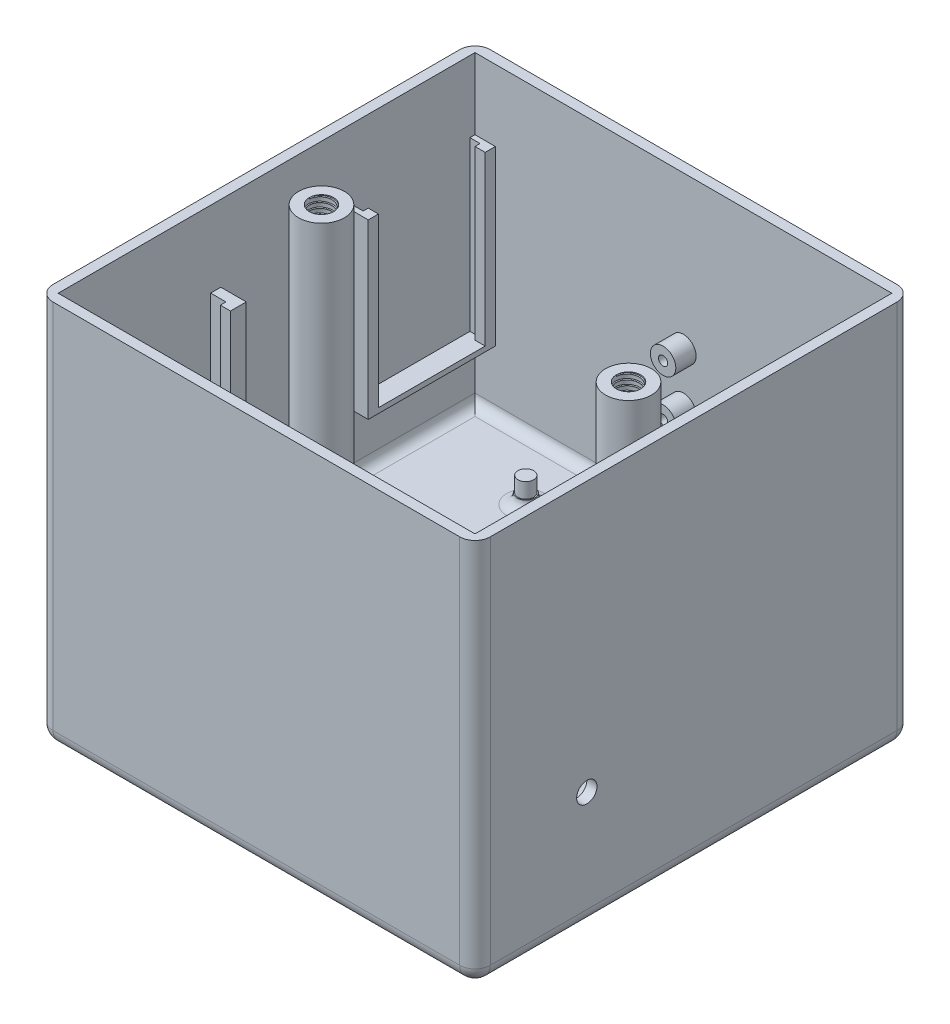
from build123d import *
from build123d.topology import SkipClean

# Parameters (mm, degrees)
SKETCH1_W               = 86
SKETCH1_H               = 86
BOSS_EXTRUDE1_DEPTH     = 76
SKETCH2_W               = 82
SKETCH2_H               = 82
CUT_EXTRUDE1_DEPTH      = 60
SKETCH3_R               = 1.75
BOSS_EXTRUDE3_DEPTH     = 2
SKETCH5_R               = 1.55
BOSS_EXTRUDE4_DEPTH     = 3
MIRROR2_COPY_1_SKETCH_R = 1.55
MIRROR2_COPY_1_DEPTH    = 3
SKETCH7_W               = 32
SKETCH7_H               = 32
BOSS_EXTRUDE6_DEPTH     = 5
SKETCH8_W               = 3
SKETCH8_H               = 28
CUT_EXTRUDE2_DEPTH      = 30
SKETCH9_W               = 2
SKETCH9_H               = 25.9
CUT_EXTRUDE3_DEPTH      = 30
SKETCH13_W              = 25
SKETCH13_H              = 34
BOSS_EXTRUDE7_DEPTH     = 4
SKETCH14_W              = 2
SKETCH14_H              = 23
CUT_EXTRUDE4_DEPTH      = 33
SKETCH15_W              = 2
SKETCH15_H              = 21
CUT_EXTRUDE5_DEPTH      = 33
SKETCH23_R              = 2.5
BOSS_EXTRUDE8_DEPTH     = 4
SKETCH24_R              = 0.9
CUT_EXTRUDE7_DEPTH      = 3
LPATTERN1_COUNT         = 2
LPATTERN1_PITCH         = 10
SKETCH26_R              = 4.5
BOSS_EXTRUDE9_DEPTH     = 60
SKETCH27_R              = 2.4
CUT_EXTRUDE8_DEPTH      = 40
SKETCH28_R              = 1.5
BOSS_EXTRUDE10_DEPTH    = 5
SKETCH29_R              = 0.6
CUT_EXTRUDE9_DEPTH      = 3
LPATTERN2_COUNT         = 2
LPATTERN2_PITCH         = 6.75
FILLET2_R               = 2
SKETCH34_R              = 2
CUT_EXTRUDE10_DEPTH     = 122.165176515
THREAD1_PITCH           = 1
THREAD2_PITCH           = 1
FILLET3_R               = 3


with BuildPart() as part:
    # Sketch1 → Boss-Extrude1 (new body)
    with BuildSketch(Plane(origin=(0, 0, 0), x_dir=(1, 0, 0), z_dir=(0, 1, 0))):
        Rectangle(SKETCH1_W, SKETCH1_H)
    extrude(amount=BOSS_EXTRUDE1_DEPTH)

    # Sketch2 → Cut-Extrude1 (cut)
    with BuildSketch(Plane(origin=(0, 76, 0), x_dir=(1, 0, 0), z_dir=(0, 1, 0))):
        Rectangle(SKETCH2_W, SKETCH2_H)
    extrude(amount=-CUT_EXTRUDE1_DEPTH, mode=Mode.SUBTRACT)

    # Sketch3 → Boss-Extrude3 (add)
    with BuildSketch(Plane(origin=(0, 16, 0), x_dir=(1, 0, 0), z_dir=(0, 1, 0))):
        with Locations(Location((-19, 29, 0), (0, 0, 270))):
            Circle(SKETCH3_R)
        with Locations(Location((-19, -29, 0), (0, 0, 270))):
            Circle(SKETCH3_R)
        with Locations(Location((19, -29, 0), (0, 0, 90))):
            Circle(SKETCH3_R)
        with Locations(Location((19, 29, 0), (0, 0, 90))):
            Circle(SKETCH3_R)
    extrude(amount=BOSS_EXTRUDE3_DEPTH)

    # Sketch5 → Boss-Extrude4 (add)
    with BuildSketch(Plane(origin=(0, 18, 0), x_dir=(1, 0, 0), z_dir=(0, 1, 0))):
        with Locations(Location((-19, 29, 0), (0, 0, 270))):
            Circle(SKETCH5_R)
    boss_extrude4 = extrude(amount=BOSS_EXTRUDE4_DEPTH)

    # Mirror1: Boss-Extrude4 across plane
    add(boss_extrude4.mirror(Plane(origin=(0, 0, 0), x_dir=(0, 0, 1), z_dir=(1, 0, 0))))

    # Mirror2: Boss-Extrude4 across plane
    add(boss_extrude4.mirror(Plane.XY))

    # Mirror2 copy 1 sketch → Mirror2 copy 1 (add)
    with BuildSketch(Plane(origin=(0, 18, 0), x_dir=(-1, 0, 0), z_dir=(0, 1, 0))):
        with Locations(Location((-19, 29, 0), (0, 0, 270))):
            Circle(MIRROR2_COPY_1_SKETCH_R)
    extrude(amount=MIRROR2_COPY_1_DEPTH)

    # Sketch7 → Boss-Extrude6 (add)
    with BuildSketch(Plane(origin=(-41, 0, 0), x_dir=(0, 0, -1), z_dir=(1, 0, 0))):
        with Locations((-25, 45.023384729)):
            Rectangle(SKETCH7_W, SKETCH7_H)
    extrude(amount=BOSS_EXTRUDE6_DEPTH)

    # Sketch8 → Cut-Extrude2 (cut)
    with BuildSketch(Plane(origin=(0, 61.023384729, 0), x_dir=(1, 0, 0), z_dir=(0, 1, 0))):
        with Locations((-39.5, -25)):
            Rectangle(SKETCH8_W, SKETCH8_H)
    extrude(amount=-CUT_EXTRUDE2_DEPTH, mode=Mode.SUBTRACT)

    # Sketch9 → Cut-Extrude3 (cut)
    with BuildSketch(Plane(origin=(0, 61.023384729, 0), x_dir=(1, 0, 0), z_dir=(0, 1, 0))):
        with Locations((-37, -25.05)):
            Rectangle(SKETCH9_W, SKETCH9_H)
    extrude(amount=-CUT_EXTRUDE3_DEPTH, mode=Mode.SUBTRACT)

    # Sketch13 → Boss-Extrude7 (add)
    with BuildSketch(Plane(origin=(-41, 0, 0), x_dir=(0, 0, -1), z_dir=(1, 0, 0))):
        with Locations((28.5, 45)):
            Rectangle(SKETCH13_W, SKETCH13_H)
    extrude(amount=BOSS_EXTRUDE7_DEPTH)

    # Sketch14 → Cut-Extrude4 (cut)
    with BuildSketch(Plane(origin=(0, 62, 0), x_dir=(1, 0, 0), z_dir=(0, 1, 0))):
        with Locations((-40, 28.5)):
            Rectangle(SKETCH14_W, SKETCH14_H)
    extrude(amount=-CUT_EXTRUDE4_DEPTH, mode=Mode.SUBTRACT)

    # Sketch15 → Cut-Extrude5 (cut)
    with BuildSketch(Plane(origin=(0, 62, 0), x_dir=(1, 0, 0), z_dir=(0, 1, 0))):
        with Locations((-38, 28.5)):
            Rectangle(SKETCH15_W, SKETCH15_H)
    extrude(amount=-CUT_EXTRUDE5_DEPTH, mode=Mode.SUBTRACT)

    # Sketch23 → Boss-Extrude8 (add)
    with BuildSketch(Plane.XY.offset(-41)):
        with Locations(Location((0, 46, 0), (0, 0, 180))):
            Circle(SKETCH23_R)
    boss_extrude8 = extrude(amount=BOSS_EXTRUDE8_DEPTH)

    # Sketch24 → Cut-Extrude7 (cut)
    with BuildSketch(Plane.XY.offset(-37)):
        with Locations((0, 46)):
            Circle(SKETCH24_R)
    cut_extrude7 = extrude(amount=-CUT_EXTRUDE7_DEPTH, mode=Mode.SUBTRACT)

    # LPattern1: Boss-Extrude8, Cut-Extrude7 ×2
    with Locations(*[(0, -i * LPATTERN1_PITCH, 0) for i in range(1, LPATTERN1_COUNT)]):
        add(boss_extrude8)
        add(cut_extrude7, mode=Mode.SUBTRACT)

    # Sketch26 → Boss-Extrude9 (add)
    with BuildSketch(Plane(origin=(0, 16, 0), x_dir=(1, 0, 0), z_dir=(0, 1, 0))):
        with Locations(Location((-30.2, 0, 0), (0, 0, 270))):
            Circle(SKETCH26_R)
    boss_extrude9 = extrude(amount=BOSS_EXTRUDE9_DEPTH)

    # Sketch27 → Cut-Extrude8 (cut)
    with BuildSketch(Plane(origin=(0, 76, 0), x_dir=(1, 0, 0), z_dir=(0, 1, 0))):
        with Locations(Location((-30.2, 0, 0), (0, 0, 270))):
            Circle(SKETCH27_R)
    cut_extrude8 = extrude(amount=-CUT_EXTRUDE8_DEPTH, mode=Mode.SUBTRACT)

    # Mirror3: Boss-Extrude9, Cut-Extrude8 across plane
    add(boss_extrude9.mirror(Plane(origin=(0, 0, 0), x_dir=(0, 0, 1), z_dir=(1, 0, 0))))
    add(cut_extrude8.mirror(Plane(origin=(0, 0, 0), x_dir=(0, 0, 1), z_dir=(1, 0, 0))), mode=Mode.SUBTRACT)

    # Sketch28 → Boss-Extrude10 (add)
    with BuildSketch(Plane(origin=(0, 0, 41), x_dir=(-1, 0, 0), z_dir=(0, 0, -1))):
        with Locations(Location((-24.25, 56, 0), (0, 0, 180))):
            Circle(SKETCH28_R)
        with Locations(Location((24.25, 56, 0), (0, 0, 180))):
            Circle(SKETCH28_R)
        with Locations(Location((-24.25, 42.5, 0), (0, 0, 180))):
            Circle(SKETCH28_R)
        with Locations(Location((24.25, 42.5, 0), (0, 0, 180))):
            Circle(SKETCH28_R)
    boss_extrude10 = extrude(amount=BOSS_EXTRUDE10_DEPTH)

    # Sketch29 → Cut-Extrude9 (cut)
    with BuildSketch(Plane(origin=(0, 0, 36), x_dir=(-1, 0, 0), z_dir=(0, 0, -1))):
        with Locations((-24.25, 56)):
            Circle(SKETCH29_R)
        with Locations((-24.25, 42.5)):
            Circle(SKETCH29_R)
        with Locations((24.25, 56)):
            Circle(SKETCH29_R)
        with Locations((24.25, 42.5)):
            Circle(SKETCH29_R)
    cut_extrude9 = extrude(amount=-CUT_EXTRUDE9_DEPTH, mode=Mode.SUBTRACT)

    # LPattern2: Boss-Extrude10, Cut-Extrude9 ×2
    with Locations(*[(0, -i * LPATTERN2_PITCH, 0) for i in range(1, LPATTERN2_COUNT)]):
        add(boss_extrude10)
        add(cut_extrude9, mode=Mode.SUBTRACT)

    # Fillet2
    fillet2_edges = [part.edges().sort_by_distance(p)[0] for p in [
        (41, 16, 0),
        (0, 16, 41),
        (-30.2, 16, -4.5),
        (-41, 16, 0),
        (30.2, 16, -4.5),
        (0, 16, -41),
        (-19, 16, -30.75),
        (-19, 16, 27.25),
        (19, 16, -27.25),
        (19, 16, 30.75),
    ]]
    fillet(fillet2_edges, radius=FILLET2_R - 0.0001)  # a hair under: the kernel refuses the full size

    # Sketch34 → Cut-Extrude10 (cut, through all)
    with BuildSketch(Plane.ZY.offset(-41)):
        with Locations((21, 23)):
            Circle(SKETCH34_R)
    extrude(amount=-CUT_EXTRUDE10_DEPTH, mode=Mode.SUBTRACT)

    # Thread1: the profile of Thread Profile2 profile screwed along a right-hand helix of 20 turns, 8 arcs to a turn; built about Z, then put on its axis
    thread1_z = Axis((0, 0, 0), (0, 0, 1))
    thread1_corners = [(2.4003, 0, -0.000173205), (2.4003, 0, 0.277985704), (2.228148085, 0, 0.17859375), (2.228148085, 0, 0.09921875)]
    with BuildLine(mode=Mode.PRIVATE) as thread1_profile:
        Line(thread1_corners[0], thread1_corners[1])
        Line(thread1_corners[1], thread1_corners[2])
        Line(thread1_corners[2], thread1_corners[3])
        Line(thread1_corners[3], thread1_corners[0])
    thread1_cap = Face(thread1_profile.wire())
    thread1_turn_angles = [0, 22.5, 45, 67.5, 90, 112.5, 135, 157.5, 180, 202.5, 225, 247.5, 270, 292.5, 315, 337.5, 360]
    thread1_turn_weights = [1, 0.9238795325112867, 1, 0.9238795325112867, 1, 0.9238795325112867, 1, 0.9238795325112867, 1, 0.9238795325112867, 1, 0.9238795325112867, 1, 0.9238795325112867, 1, 0.9238795325112867, 1]
    thread1_turn_rails = [Edge.make_bspline([Vector(p[0], p[1], 0).rotate(thread1_z, thread1_turn_angles[k]) / thread1_turn_weights[k] + Vector(0, 0, p[2] + THREAD1_PITCH * thread1_turn_angles[k] / 360) for k in range(17)], [0, 0, 0, 1, 1, 2, 2, 3, 3, 4, 4, 5, 5, 6, 6, 7, 7, 8, 8, 8], 2, thread1_turn_weights) for p in thread1_corners]
    thread1_turn_sides = [Face.make_surface_from_curves(thread1_turn_rails[p[0]], thread1_turn_rails[p[1]]) for p in [(0, 1), (1, 2), (2, 3), (3, 0)]]
    thread1 = Plane(origin=(30.2, 76, 0), x_dir=(-1, 0, 0), z_dir=(0, -1, 0)) * Solid(Shell([*[p.moved(Location((0, 0, THREAD1_PITCH * i))) for i in range(20) for p in thread1_turn_sides], thread1_cap, thread1_cap.rotate(thread1_z, 7200).moved(Location((0, 0, THREAD1_PITCH * 7200 / 360)))]))
    add(thread1)

    # Thread2: the profile of Thread Profile3 profile screwed along a right-hand helix of 20 turns, 8 arcs to a turn; built about Z, then put on its axis
    with SkipClean():  # the faces are left unmerged after this step: merging them gives an invalid solid
        thread2_z = Axis((0, 0, 0), (0, 0, 1))
        thread2_corners = [(2.4003, 0, -0.000173205), (2.4003, 0, 0.277985704), (2.228148085, 0, 0.17859375), (2.228148085, 0, 0.09921875)]
        with BuildLine(mode=Mode.PRIVATE) as thread2_profile:
            Line(thread2_corners[0], thread2_corners[1])
            Line(thread2_corners[1], thread2_corners[2])
            Line(thread2_corners[2], thread2_corners[3])
            Line(thread2_corners[3], thread2_corners[0])
        thread2_cap = Face(thread2_profile.wire())
        thread2_turn_angles = [0, 22.5, 45, 67.5, 90, 112.5, 135, 157.5, 180, 202.5, 225, 247.5, 270, 292.5, 315, 337.5, 360]
        thread2_turn_weights = [1, 0.9238795325112867, 1, 0.9238795325112867, 1, 0.9238795325112867, 1, 0.9238795325112867, 1, 0.9238795325112867, 1, 0.9238795325112867, 1, 0.9238795325112867, 1, 0.9238795325112867, 1]
        thread2_turn_rails = [Edge.make_bspline([Vector(p[0], p[1], 0).rotate(thread2_z, thread2_turn_angles[k]) / thread2_turn_weights[k] + Vector(0, 0, p[2] + THREAD2_PITCH * thread2_turn_angles[k] / 360) for k in range(17)], [0, 0, 0, 1, 1, 2, 2, 3, 3, 4, 4, 5, 5, 6, 6, 7, 7, 8, 8, 8], 2, thread2_turn_weights) for p in thread2_corners]
        thread2_turn_sides = [Face.make_surface_from_curves(thread2_turn_rails[p[0]], thread2_turn_rails[p[1]]) for p in [(0, 1), (1, 2), (2, 3), (3, 0)]]
        thread2 = Plane(origin=(-30.2, 76, 0), x_dir=(-1, 0, 0), z_dir=(0, -1, 0)) * Solid(Shell([*[p.moved(Location((0, 0, THREAD2_PITCH * i))) for i in range(20) for p in thread2_turn_sides], thread2_cap, thread2_cap.rotate(thread2_z, 7200).moved(Location((0, 0, THREAD2_PITCH * 7200 / 360)))]))
        add(thread2)

    # Fillet3
    fillet3_edges = [part.edges().sort_by_distance(p)[0] for p in [
        (0, 0, 43),
        (-43, 0, 0),
        (0, 0, -43),
        (43, 0, 0),
        (43, 38, 43),
        (-43, 38, 43),
        (-43, 38, -43),
        (43, 38, -43),
    ]]
    fillet(fillet3_edges, radius=FILLET3_R)


solid = part.part
